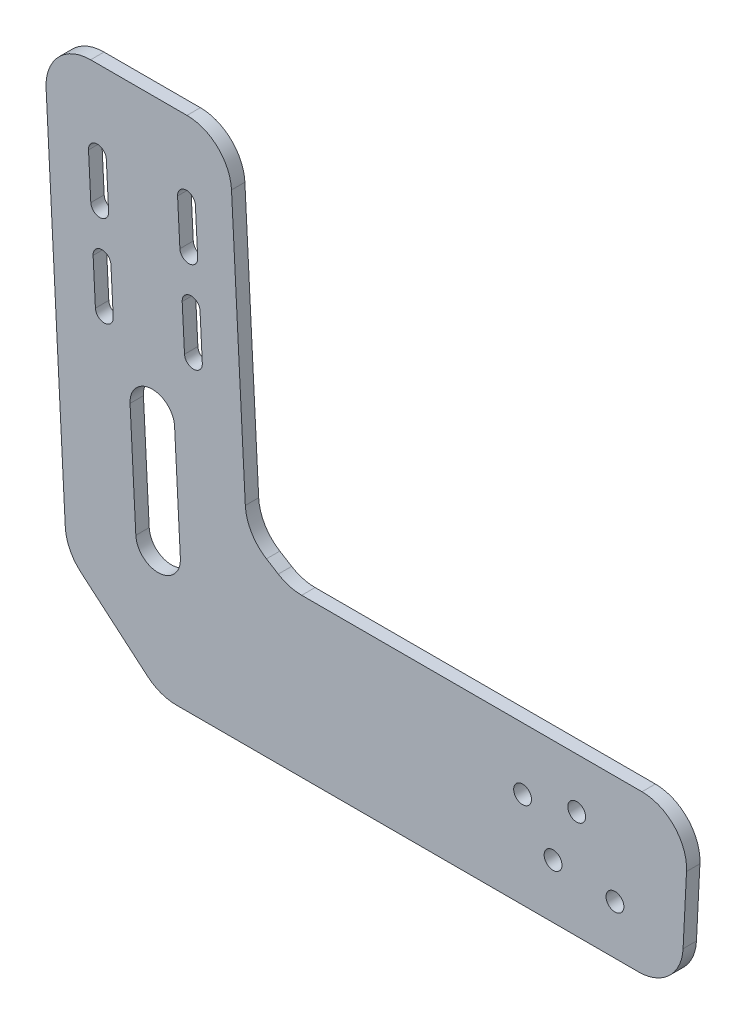
from build123d import *

# Parameters (mm, degrees)
BOSS_EXTRUDE1_DEPTH = 4
SCALE4_SCALE        = 0.75919
FILLET6_R           = 3
FILLET7_R           = 3
SKETCH2_R           = 2
BOSS_EXTRUDE2_DEPTH = 3
CUT_EXTRUDE1_START  = -10
SKETCH3_R           = 2
CUT_EXTRUDE1_DEPTH  = 10


with BuildPart() as part:
    # Sketch1 → Boss-Extrude1 (new body)
    with BuildSketch(Plane.XY):
        Polygon((139.887521377, 204.056894723), (141.24778548, 208.242322731), (144.835713473, 210.070135105), (160.500754315, 210.070135105), (167.622266071, 208.242322731), (172.522669487, 205.831679823), (175.619724447, 203.675502319), (178.946764591, 200.233807794), (179.037084843, 200.056512483), (183.5160481, 193.501931379), (185.301557704, 187.487393826), (185.539112291, 184.563645059), (184.954362538, 182.355057305), (184.113784767, 181.109966828), (182.651910383, 180.178021908), (181.232301611, 180.178021908), (171.271612606, 180.178021908), (153.63070922, 182.355057305), (151.966131288, 182.789295026), (149.384829279, 183.363134026), (148.208709289, 184.36807152), (147.189516356, 185.643755739), (145.029311699, 190.88387399), (141.644867129, 197.274737006), align=None)
    extrude(amount=BOSS_EXTRUDE1_DEPTH)


with BuildPart() as part_1:
    # Scale4: scaled about (162.417336375, 194.870616826, 2)
    add(part.part.scale(SCALE4_SCALE).moved(Location((39.111718772, 46.926793238, 0.48162))))

    # Fillet6
    # the kernel refuses this fillet: 3 mm, written as the material it adds along each edge
    with BuildSketch(Plane(origin=(175.034883215, 198.80769695, 0.48162), x_dir=(0.5641904622979087, -0.8256446706980383, 0), z_dir=(0, 0, 1))) as fillet6_piece_1_section:
        with BuildLine():
            CenterArc((FILLET6_R * 0.0642311981219, FILLET6_R), FILLET6_R, 262.649743959, 7.350256041)
            Line((-FILLET6_R * 0.063703385216, FILLET6_R * 0.00821739156901), (0, 0))
            Line((0, 0), (FILLET6_R * 0.0642311981219, 0))
        make_face()
    fillet6_piece_1 = extrude(amount=3.03676, mode=Mode.PRIVATE)
    fillet6_piece_1 = split(fillet6_piece_1, bisect_by=Plane(origin=(175.064317261, 198.840916135, 2), z_dir=(-0.7189811970622167, -0.6950295233088893, 0)), keep=Keep.TOP, mode=Mode.PRIVATE)
    add(fillet6_piece_1)
    with BuildSketch(Plane(origin=(154.482885985, 185.698598128, 0.48162), x_dir=(-0.9761697325769959, 0.21700841734954968, 0), z_dir=(0, 0, 1))) as fillet6_piece_2:
        with BuildLine():
            CenterArc((FILLET6_R * 0.0182188067452, FILLET6_R), FILLET6_R, 267.912509474, 2.087490526)
            Line((-FILLET6_R * 0.0182067162065, FILLET6_R * 0.000663629563253), (0, 0))
            Line((0, 0), (FILLET6_R * 0.0182188067452, 0))
        make_face()
    extrude(amount=3.03676)
    with BuildSketch(Plane(origin=(149.216521921, 191.843921532, 0.48162), x_dir=(-0.4680007470830183, 0.8837280694476876, 0), z_dir=(0, 0, 1))) as fillet6_piece_3:
        with BuildLine():
            CenterArc((FILLET6_R * 0.0480422965927, FILLET6_R), FILLET6_R, 264.498987959, 5.501012041)
            Line((-FILLET6_R * 0.0478210380477, FILLET6_R * 0.00460549475516), (0, 0))
            Line((0, 0), (FILLET6_R * 0.0480422965927, 0))
        make_face()
    extrude(amount=3.03676)
    # the kernel refuses this fillet: 3 mm, written as the material it takes off along each edge
    with BuildSketch(Plane(origin=(170.089204221, 203.192146242, -0.085723646), x_dir=(0.8206934047378623, -0.5713688260832711, 0), z_dir=(0, 0, 1))) as fillet6_2_piece_1:
        with BuildLine():
            CenterArc((FILLET6_R * 0.0756458194575, -FILLET6_R), FILLET6_R, 90, 8.651894609)
            Line((-FILLET6_R * 0.0747850106227, -FILLET6_R * 0.0113794634131), (0, 0))
            Line((0, 0), (FILLET6_R * 0.0756458194575, 0))
        make_face()
    extrude(amount=4.171447292, mode=Mode.SUBTRACT)
    with BuildSketch(Plane(origin=(179.790808366, 189.265347757, -0.299334996), x_dir=(0.08098313210757263, -0.9967154720952452, 0), z_dir=(0, 0, 1))) as fillet6_2_piece_2:
        with BuildLine():
            CenterArc((FILLET6_R * 0.104127332747, -FILLET6_R), FILLET6_R, 90, 11.889267137)
            Line((-FILLET6_R * 0.101893551021, -FILLET6_R * 0.0214524051169), (0, 0))
            Line((0, 0), (FILLET6_R * 0.104127332747, 0))
        make_face()
    extrude(amount=4.598669991, mode=Mode.SUBTRACT)
    with BuildSketch(Plane(origin=(179.527221267, 185.368929193, -0.786529904), x_dir=(-0.5595376521790817, -0.8288049322934323, 0), z_dir=(0, 0, 1))) as fillet6_2_piece_3:
        with BuildLine():
            CenterArc((FILLET6_R * 0.169086653883, -FILLET6_R), FILLET6_R, 90, 19.194353316)
            Line((-FILLET6_R * 0.159686919919, -FILLET6_R * 0.0555912234793), (0, 0))
            Line((0, 0), (FILLET6_R * 0.169086653883, 0))
        make_face()
    extrude(amount=5.573059808, mode=Mode.SUBTRACT)
    with BuildSketch(Plane(origin=(178.435267329, 193.831524522, -0.693636489), x_dir=(0.2845900515763164, -0.9586493115544337, 0), z_dir=(0, 0, 1))) as fillet6_2_piece_4:
        with BuildLine():
            CenterArc((FILLET6_R * 0.156700865162, -FILLET6_R), FILLET6_R, 90, 17.811748872)
            Line((-FILLET6_R * 0.149189673688, -FILLET6_R * 0.0479333120825), (0, 0))
            Line((0, 0), (FILLET6_R * 0.156700865162, 0))
        make_face()
    extrude(amount=5.387272977, mode=Mode.SUBTRACT)
    with BuildSketch(Plane(origin=(178.88906303, 184.423668954, -1.075559702), x_dir=(-0.8432271980573246, -0.5375573387615439, 0), z_dir=(0, 0, 1))) as fillet6_2_piece_5:
        with BuildLine():
            CenterArc((FILLET6_R * 0.207623960269, -FILLET6_R), FILLET6_R, 90, 23.458660046)
            Line((-FILLET6_R * 0.190463329283, -FILLET6_R * 0.0826524595894), (0, 0))
            Line((0, 0), (FILLET6_R * 0.207623960269, 0))
        make_face()
    extrude(amount=6.151119404, mode=Mode.SUBTRACT)
    with BuildSketch(Plane(origin=(169.139414347, 183.71614569, 0.020587263), x_dir=(-0.9924710740045749, 0.12247925238261967, 0), z_dir=(0, 0, 1))) as fillet6_2_piece_6:
        with BuildLine():
            CenterArc((FILLET6_R * 0.0614710316153, -FILLET6_R), FILLET6_R, 90, 7.035208973)
            Line((-FILLET6_R * 0.0610082207674, -FILLET6_R * 0.00752892599542), (0, 0))
            Line((0, 0), (FILLET6_R * 0.0614710316153, 0))
        make_face()
    extrude(amount=3.958825474, mode=Mode.SUBTRACT)
    with BuildSketch(Plane(origin=(155.746616905, 185.368929193, -0.015587097), x_dir=(-0.9676172723968424, 0.2524218971470086, 0), z_dir=(0, 0, 1))) as fillet6_2_piece_7:
        with BuildLine():
            CenterArc((FILLET6_R * 0.0662942795425, -FILLET6_R), FILLET6_R, 90, 7.585665015)
            Line((-FILLET6_R * 0.0657141117056, -FILLET6_R * 0.00875140119136), (0, 0))
            Line((0, 0), (FILLET6_R * 0.0662942795425, 0))
        make_face()
    extrude(amount=4.031174193, mode=Mode.SUBTRACT)
    with BuildSketch(Plane(origin=(150.856527695, 187.865676157, -0.587064111), x_dir=(-0.3811282524443585, 0.9245221766884282, 0), z_dir=(0, 0, 1))) as fillet6_2_piece_8:
        with BuildLine():
            CenterArc((FILLET6_R * 0.14249121477, -FILLET6_R), FILLET6_R, 90, 16.21910898)
            Line((-FILLET6_R * 0.136820147731, -FILLET6_R * 0.0397994153417), (0, 0))
            Line((0, 0), (FILLET6_R * 0.14249121477, 0))
        make_face()
    extrude(amount=5.174128222, mode=Mode.SUBTRACT)
    with BuildSketch(Plane(origin=(151.630288778, 186.897189455, -0.231632642), x_dir=(-0.6241891196597051, 0.7812732831080572, 0), z_dir=(0, 0, 1))) as fillet6_2_piece_9:
        with BuildLine():
            CenterArc((FILLET6_R * 0.0951003522105, -FILLET6_R), FILLET6_R, 90, 10.865021551)
            Line((-FILLET6_R * 0.0933955804828, -FILLET6_R * 0.0179260295894), (0, 0))
            Line((0, 0), (FILLET6_R * 0.0951003522104, 0))
        make_face()
    extrude(amount=4.463265283, mode=Mode.SUBTRACT)
    with BuildSketch(Plane(origin=(152.523187313, 186.134250959, -1.386873198), x_dir=(-0.7602667232190712, 0.6496110448304708, 0), z_dir=(0, 0, 1))) as fillet6_2_piece_10:
        with BuildLine():
            CenterArc((FILLET6_R * 0.249132426376, -FILLET6_R), FILLET6_R, 90, 27.978899274)
            Line((-FILLET6_R * 0.220013935166, -FILLET6_R * 0.116879571377), (0, 0))
            Line((0, 0), (FILLET6_R * 0.249132426376, 0))
        make_face()
    extrude(amount=6.773746396, mode=Mode.SUBTRACT)
    with BuildSketch(Plane(origin=(177.779222616, 183.71614569, -1.705674136), x_dir=(-1, 0, 0), z_dir=(0, 0, 1))) as fillet6_2_piece_11:
        with BuildLine():
            CenterArc((FILLET6_R * 0.291639218067, -FILLET6_R), FILLET6_R, 90, 32.517510615)
            Line((-FILLET6_R * 0.245918120694, -FILLET6_R * 0.156772801943), (0, 0))
            Line((0, 0), (FILLET6_R * 0.291639218067, 0))
        make_face()
    extrude(amount=7.411348271, mode=Mode.SUBTRACT)
    with BuildSketch(Plane(origin=(146.647085448, 196.695800825, -0.397967253), x_dir=(0.4680007470830723, -0.8837280694476589, 0), z_dir=(0, 0, 1))) as fillet6_2_piece_12:
        with BuildLine():
            CenterArc((FILLET6_R * 0.117278300393, FILLET6_R), FILLET6_R, 256.622007888, 13.377992112)
            Line((-FILLET6_R * 0.114095932972, FILLET6_R * 0.027135176844), (0, 0))
            Line((0, 0), (FILLET6_R * 0.117278300394, 0))
        make_face()
    extrude(amount=4.795934506, mode=Mode.SUBTRACT)

    # Fillet7
    fillet7_edges = [part_1.edges().sort_by_distance(p)[0] for p in [
        (145.312926127, 201.844747143, 2),
        (146.345625031, 205.022282232, 2),
        (160.962286441, 206.409939108, 2),
        (179.971157433, 187.04566693, 2),
    ]]
    fillet(fillet7_edges, radius=FILLET7_R)

    # Sketch2 → Boss-Extrude2 (add)
    with BuildSketch(Plane.XY.offset(3.51838)):
        with BuildLine():
            Line((188.434105361, 188.092238721), (189.20692612, 203.468129761))
            ThreePointArc((189.20692612, 203.468129761), (186.465906686, 210.861418968), (179.219533507, 213.97011461))
            Line((179.219533507, 213.97011461), (102.919230161, 213.97011461))
            ThreePointArc((102.919230161, 213.97011461), (100.192318492, 214.349098408), (97.672097891, 215.45732406))
            Line((97.672097891, 215.45732406), (95.019397498, 217.092401272))
            ThreePointArc((95.019397498, 217.092401272), (91.664314845, 220.505986156), (90.27992577, 225.087755274))
            Line((90.27992577, 225.087755274), (87.185701358, 284.806756585))
            ThreePointArc((87.185701358, 284.806756585), (84.084793931, 291.541022095), (77.19909736, 294.289320037))
            Line((77.19909736, 294.289320037), (55.59890347, 294.289320037))
            ThreePointArc((55.59890347, 294.289320037), (48.347201412, 291.175016608), (45.612299472, 283.77188349))
            Line((45.612299472, 283.77188349), (49.913159154, 200.7646381))
            ThreePointArc((49.913159154, 200.7646381), (50.934623775, 196.851919353), (53.422135939, 193.663653179))
            Line((53.422135939, 193.663653179), (68.344482326, 180.975802101))
            ThreePointArc((68.344482326, 180.975802101), (71.371328084, 179.208483997), (74.822109539, 178.59422357))
            Line((74.822109539, 178.59422357), (178.446712748, 178.59422357))
            ThreePointArc((178.446712748, 178.59422357), (185.338017106, 181.347850392), (188.434105361, 188.092238721))
        make_face()
        with Locations((173.156485543, 189.59374103)):
            Circle(SKETCH2_R, mode=Mode.SUBTRACT)
        with Locations((164.580858822, 202.751414961)):
            Circle(SKETCH2_R, mode=Mode.SUBTRACT)
        with Locations((159.281654358, 190.737720877)):
            Circle(SKETCH2_R, mode=Mode.SUBTRACT)
        with Locations((152.444215345, 200.074868776)):
            Circle(SKETCH2_R, mode=Mode.SUBTRACT)
        with BuildLine():
            Line((59.113788522, 276.765794371), (59.63122507, 266.779190373))
            ThreePointArc((59.63122507, 266.779190373), (57.73739158, 264.678382264), (55.636583471, 266.572215754))
            Line((55.636583471, 266.572215754), (55.119146923, 276.558819752))
            ThreePointArc((55.119146923, 276.558819752), (57.012980413, 278.659627861), (59.113788522, 276.765794371))
        make_face(mode=Mode.SUBTRACT)
        with BuildLine():
            Line((79.086996519, 277.800667467), (79.604433066, 267.814063469))
            ThreePointArc((79.604433066, 267.814063469), (77.710599576, 265.713255359), (75.609791467, 267.607088849))
            Line((75.609791467, 267.607088849), (75.092354919, 277.593692848))
            ThreePointArc((75.092354919, 277.593692848), (76.986188409, 279.694500957), (79.086996519, 277.800667467))
        make_face(mode=Mode.SUBTRACT)
        with BuildLine():
            Line((60.666098165, 246.805982376), (60.148661618, 256.792586375))
            ThreePointArc((60.148661618, 256.792586375), (58.047853508, 258.686419865), (56.154020018, 256.585611756))
            Line((56.154020018, 256.585611756), (56.671456566, 246.599007757))
            ThreePointArc((56.671456566, 246.599007757), (58.772264675, 244.705174267), (60.666098165, 246.805982376))
        make_face(mode=Mode.SUBTRACT)
        with BuildLine():
            Line((80.639306162, 247.840855472), (80.121869614, 257.82745947))
            ThreePointArc((80.121869614, 257.82745947), (78.021061505, 259.72129296), (76.127228015, 257.620484851))
            Line((76.127228015, 257.620484851), (76.644664563, 247.633880853))
            ThreePointArc((76.644664563, 247.633880853), (78.745472672, 245.740047363), (80.639306162, 247.840855472))
        make_face(mode=Mode.SUBTRACT)
        with BuildLine():
            Line((74.424838185, 232.498743891), (75.718429554, 207.532233895))
            ThreePointArc((75.718429554, 207.532233895), (70.983845829, 202.280213622), (65.731825556, 207.014797347))
            Line((65.731825556, 207.014797347), (64.438234187, 231.981307343))
            ThreePointArc((64.438234187, 231.981307343), (69.172817912, 237.233327616), (74.424838185, 232.498743891))
        make_face(mode=Mode.SUBTRACT)
    extrude(amount=BOSS_EXTRUDE2_DEPTH)

    # Sketch3 → Cut-Extrude1 (cut)
    with BuildSketch(Plane.XY.offset(3.51838).offset(CUT_EXTRUDE1_START)):
        with Locations(Location((164.580858822, 202.751414961, 0), (0, 0, 180))):
            Circle(SKETCH3_R)
        with Locations(Location((173.156485543, 189.59374103, 0), (0, 0, 180))):
            Circle(SKETCH3_R)
    extrude(amount=CUT_EXTRUDE1_DEPTH, mode=Mode.SUBTRACT)


solid = part_1.part
